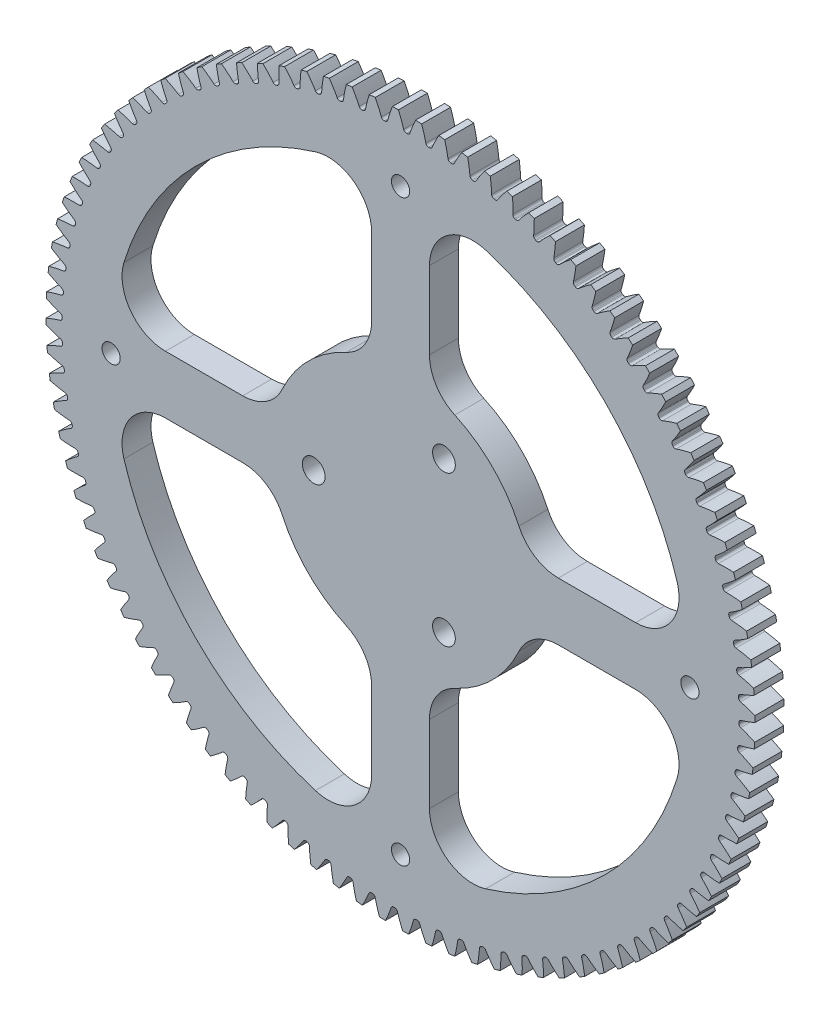
from build123d import *

# Parameters (mm, degrees)
SKETCH3_R          = 77.7875
GEARBODY_DEPTH     = 6.35
TOOTHCUT_DEPTH     = 111.191255608
CIRPATTERN1_COUNT  = 96
SKETCH4_R          = 2.499999953
CUT_EXTRUDE1_DEPTH = 111.189345242
SKETCH5_R          = 2.000000064
CUT_EXTRUDE2_DEPTH = 111.189345242
CUT_EXTRUDE3_DEPTH = 111.189345242
CIRPATTERN2_COUNT  = 4
FILLET1_R          = 9.525


with BuildPart() as part:
    # Sketch3 → gearBody (new body)
    with BuildSketch(Plane.XY):
        Circle(SKETCH3_R)
    extrude(amount=GEARBODY_DEPTH)

    # Sketch2 → toothCut (cut, through all)
    with BuildSketch(Plane.XY):
        with BuildLine():
            ThreePointArc((74.229645105, -1.470041256), (74.231652244, -1.364931764), (74.233510549, -1.259819536))
            ThreePointArc((74.233510549, -1.259819536), (74.357469475, -0.900065574), (74.669516207, -0.682314421))
            ThreePointArc((74.669516207, -0.682314421), (83.521868489, 3.746156538), (90.39842703, 10.865737887))
            ThreePointArc((90.39842703, 10.865737887), (91.033719016, -1.673879146), (89.937868837, -14.181664866))
            ThreePointArc((89.937868837, -14.181664866), (83.327692223, -6.814096673), (74.644125506, -2.063184652))
            ThreePointArc((74.644125506, -2.063184652), (74.340294784, -1.834109074), (74.229645105, -1.470041256))
        make_face()
    toothcut = extrude(amount=TOOTHCUT_DEPTH, mode=Mode.SUBTRACT)

    # CirPattern1: toothCut ×96 about axis
    cirpattern1_axis = Axis((0, 0, 6.35), (0, 0, -1))
    for i in range(1, CIRPATTERN1_COUNT):
        add(toothcut.rotate(cirpattern1_axis, i * 360 / CIRPATTERN1_COUNT), mode=Mode.SUBTRACT)

    # Sketch4 → Cut-Extrude1 (cut, through all)
    with BuildSketch(Plane(origin=(0, 0, 0), x_dir=(-1, 0, 0), z_dir=(0, 0, -1))):
        with Locations((19.05, 0)):
            Circle(SKETCH4_R)
        with Locations((-9.525, -16.497783942)):
            Circle(SKETCH4_R)
        with Locations((-9.525, 16.497783942)):
            Circle(SKETCH4_R)
    extrude(amount=-CUT_EXTRUDE1_DEPTH, mode=Mode.SUBTRACT)

    # Sketch5 → Cut-Extrude2 (cut, through all)
    with BuildSketch(Plane(origin=(0, 0, 0), x_dir=(-1, 0, 0), z_dir=(0, 0, -1))):
        with Locations((63.5, 0)):
            Circle(SKETCH5_R)
        with Locations((0, -63.5)):
            Circle(SKETCH5_R)
        with Locations((-63.5, 0)):
            Circle(SKETCH5_R)
        with Locations((0, 63.5)):
            Circle(SKETCH5_R)
    extrude(amount=-CUT_EXTRUDE2_DEPTH, mode=Mode.SUBTRACT)

    # Sketch6 → Cut-Extrude3 (cut, through all)
    with BuildSketch(Plane(origin=(0, 0, 0), x_dir=(-1, 0, 0), z_dir=(0, 0, -1))):
        with BuildLine():
            Line((6.35, 63.181702256), (6.35, 27.86051193))
            ThreePointArc((6.35, 27.86051193), (20.205576272, 20.205576272), (27.86051193, 6.35))
            Line((27.86051193, 6.35), (63.181702256, 6.35))
            ThreePointArc((63.181702256, 6.35), (44.901280605, 44.901280605), (6.35, 63.181702256))
        make_face()
    cut_extrude3 = extrude(amount=-CUT_EXTRUDE3_DEPTH, mode=Mode.SUBTRACT)

    # CirPattern2: Cut-Extrude3 ×4 about axis
    cirpattern2_axis = Axis((0, 0, 0), (0, 0, -1))
    for i in range(1, CIRPATTERN2_COUNT):
        add(cut_extrude3.rotate(cirpattern2_axis, i * 360 / CIRPATTERN2_COUNT), mode=Mode.SUBTRACT)

    # Fillet1
    fillet1_edges = [part.edges().sort_by_distance(p)[0] for p in [
        (-27.86051193, -6.35, 3.175),
        (-6.35, -27.86051193, 3.175),
        (6.35, -27.86051193, 3.175),
        (27.86051193, -6.35, 3.175),
        (27.86051193, 6.35, 3.175),
        (6.35, 27.86051193, 3.175),
        (-27.86051193, 6.35, 3.175),
        (-6.35, 27.86051193, 3.175),
        (-6.35, 63.181702256, 3.175),
        (6.35, 63.181702256, 3.175),
        (63.181702256, 6.35, 3.175),
        (63.181702256, -6.35, 3.175),
        (6.35, -63.181702256, 3.175),
        (-6.35, -63.181702256, 3.175),
        (-63.181702256, -6.35, 3.175),
        (-63.181702256, 6.35, 3.175),
    ]]
    fillet(fillet1_edges, radius=FILLET1_R)


solid = part.part
